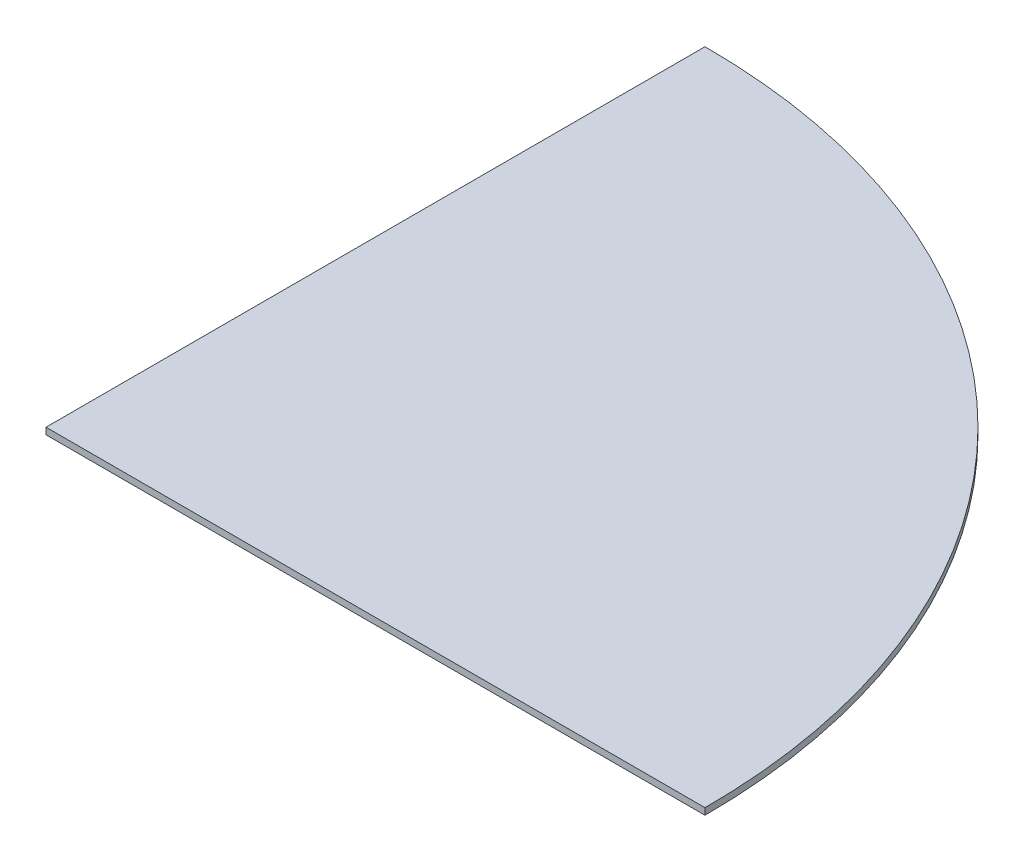
from build123d import *

# Parameters (mm, degrees)
BASE_FLANGE1_DEPTH = 10


# Sheet-metal steps are written as plain solids
with BuildPart() as part:
    # Sketch1 → Base-Flange1 (new body)
    with BuildSketch(Plane(origin=(0, 0, 0), x_dir=(1, 0, 0), z_dir=(0, 1, 0))):
        with BuildLine():
            Line((0, 0), (0, 1000))
            ThreePointArc((0, 1000), (707.106781187, 707.106781187), (1000, 0))
            Line((1000, 0), (0, 0))
        make_face()
    extrude(amount=BASE_FLANGE1_DEPTH)


solid = part.part
